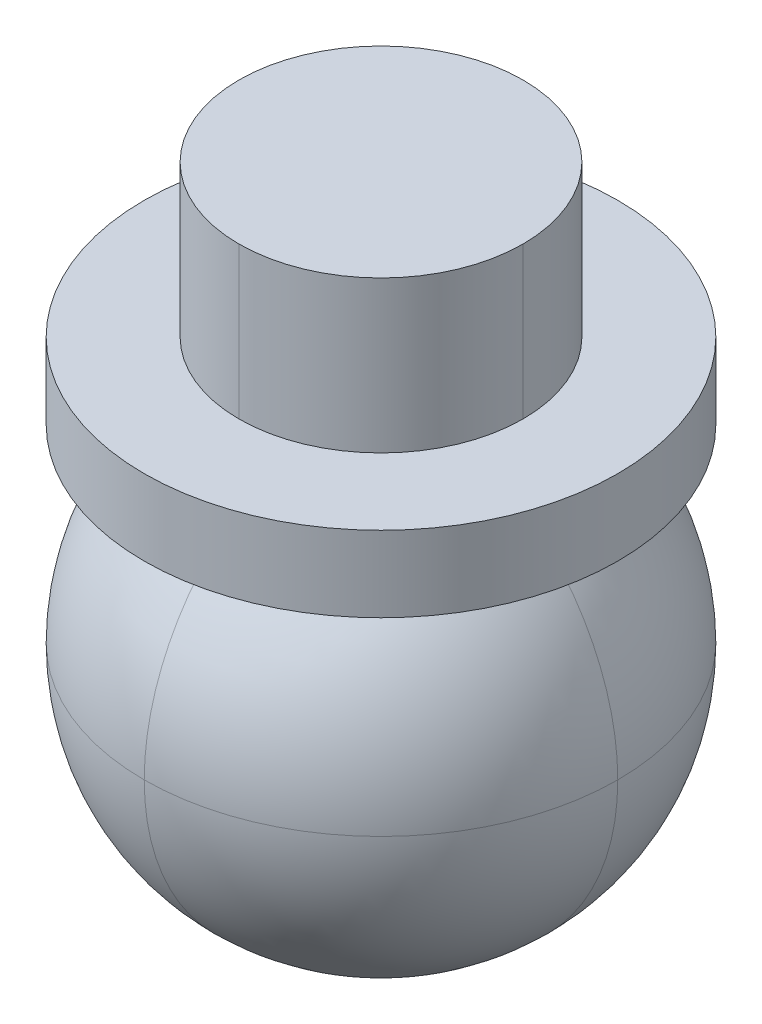
from build123d import *

# Parameters (mm, degrees)
SKETCH1_W                = 2.5
SKETCH1_H                = 0.8
SURFACE_EXTRUDE1_1_BACK  = 5
SURFACE_EXTRUDE1_1_DEPTH = 10


# Read off the part's stored shape, not the designer's step: Stock-Ball_socket_test-1
with BuildPart() as part:
    # Stock-Ball_socket_test-1 outline → Stock-Ball_socket_test-1 (revolve)
    with BuildSketch(Plane(origin=(-8, 0, 0), x_dir=(1, 0, 0), z_dir=(0, 0, 1))):
        with BuildLine():
            ThreePointArc((0, 0), (1.767766953, 0.732233047), (2.5, 2.5))
            ThreePointArc((2.5, 2.5), (2.236067977, 3.618033989), (1.5, 4.5))
            Line((1.5, 4.5), (1.5, 7.5))
            Line((1.5, 7.5), (0, 7.5))
            Line((0, 7.5), (0, 0))
        make_face()
    revolve(axis=Axis((-8, 0, 0), (0, 1, 0)))

    # Sketch1 → Revolve1 (revolve)
    with BuildSketch(Plane.XY, mode=Mode.PRIVATE) as revolve1_sk:
        with Locations((-9.25, 4.9)):
            Rectangle(SKETCH1_W, SKETCH1_H)
    revolve(revolve1_sk.sketch.rotate(Axis((-8, 0, 0), (0, 1, 0)), 270), axis=Axis((-8, 0, 0), (0, 1, 0)))

    # SurfaceCut1: cut with a surface, the side behind it stays
    # Surface-Extrude1: a surface, the sketch's curves swept straight by 10 mm
    with BuildLine(Plane.XY.offset(-SURFACE_EXTRUDE1_1_BACK), mode=Mode.PRIVATE) as surface_extrude1_1_path:
        Line((-10.166377041, 6.9), (-4.598288461, 6.9))
    surface_extrude1_1 = Shell.extrude(surface_extrude1_1_path.wire(), (0 * SURFACE_EXTRUDE1_1_DEPTH, 0 * SURFACE_EXTRUDE1_1_DEPTH, 1 * SURFACE_EXTRUDE1_1_DEPTH))
    split(bisect_by=surface_extrude1_1, keep=Keep.BOTTOM)


solid = part.part
